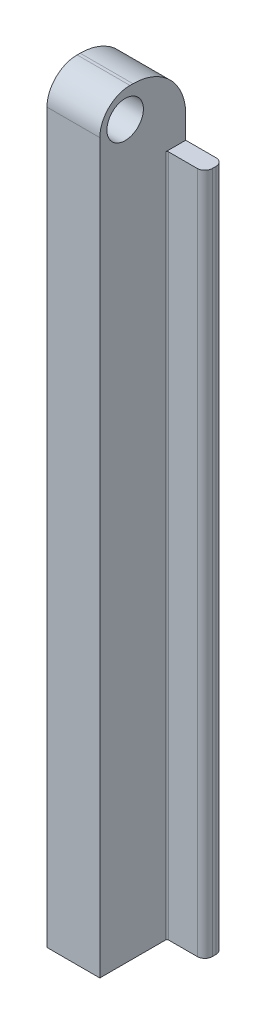
from build123d import *

# Parameters (mm, degrees)
SKETCH1_W           = 21.595753519
SKETCH1_H           = 14.478
BOSS_EXTRUDE1_DEPTH = 154.432
SKETCH2_W           = 6.322581804
SKETCH2_H           = 11.387875745
CUT_EXTRUDE1_DEPTH  = 169.418
SKETCH3_W           = 6.363734986
SKETCH3_H           = 11.33360049
CUT_EXTRUDE2_DEPTH  = 184.912
FILLET2_R           = 1.27
FILLET3_R           = 1.27
FILLET4_R           = 1.27
FILLET5_R           = 0.254
FILLET6_R           = 1.27
SKETCH5_R           = 3.075760473
CUT_EXTRUDE4_DEPTH  = 27.084813675
FILLET7_R           = 0.254
CUT_EXTRUDE5_DEPTH  = 26.67
SKETCH8_W           = 9.146003961
SKETCH8_H           = 12.7
CUT_EXTRUDE6_DEPTH  = 157.605337323
FILLET9_R           = 8.89
FILLET10_R          = 5.08


with BuildPart() as part:
    # Sketch1 → Boss-Extrude1 (new body)
    with BuildSketch(Plane(origin=(0, 0, 0), x_dir=(1, 0, 0), z_dir=(0, 1, 0))):
        with Locations((-10.79787676, -7.239)):
            Rectangle(SKETCH1_W, SKETCH1_H)
    extrude(amount=BOSS_EXTRUDE1_DEPTH)

    # Sketch2 → Cut-Extrude1 (cut)
    with BuildSketch(Plane(origin=(0, 154.432, 0), x_dir=(1, 0, 0), z_dir=(0, 1, 0))):
        with Locations((-18.434462617, -8.784062128)):
            Rectangle(SKETCH2_W, SKETCH2_H)
    extrude(amount=-CUT_EXTRUDE1_DEPTH, mode=Mode.SUBTRACT)

    # Sketch3 → Cut-Extrude2 (cut)
    with BuildSketch(Plane(origin=(0, 154.432, 0), x_dir=(1, 0, 0), z_dir=(0, 1, 0))):
        with Locations((-3.181867493, -8.811199755)):
            Rectangle(SKETCH3_W, SKETCH3_H)
    extrude(amount=-CUT_EXTRUDE2_DEPTH, mode=Mode.SUBTRACT)

    # Fillet2
    fillet2_edges = [part.edges().sort_by_distance(p)[0] for p in [
        (-21.595753519, 77.216, 3.090124255),
    ]]
    fillet(fillet2_edges, radius=FILLET2_R)

    # Fillet3
    fillet3_edges = [part.edges().sort_by_distance(p)[0] for p in [
        (-21.595753519, 77.216, 0),
    ]]
    fillet(fillet3_edges, radius=FILLET3_R)

    # Fillet4
    fillet4_edges = [part.edges().sort_by_distance(p)[0] for p in [
        (0, 77.216, 0),
    ]]
    fillet(fillet4_edges, radius=FILLET4_R)

    # Fillet5
    fillet5_edges = [part.edges().sort_by_distance(p)[0] for p in [
        (-6.363734986, 77.216, 3.14439951),
    ]]
    fillet(fillet5_edges, radius=FILLET5_R)

    # Fillet6
    fillet6_edges = [part.edges().sort_by_distance(p)[0] for p in [
        (0, 77.216, 3.14439951),
    ]]
    fillet(fillet6_edges, radius=FILLET6_R)

    # Sketch5 → Cut-Extrude4 (cut)
    with BuildSketch(Plane.ZY.offset(15.273171715)):
        with Locations((10.21002492, 149.86)):
            Circle(SKETCH5_R)
    extrude(amount=-CUT_EXTRUDE4_DEPTH, mode=Mode.SUBTRACT)

    # Fillet7
    fillet7_edges = [part.edges().sort_by_distance(p)[0] for p in [
        (-15.273171715, 77.216, 3.090124255),
    ]]
    fillet(fillet7_edges, radius=FILLET7_R)

    # Sketch6 → Cut-Extrude5 (cut)
    with BuildSketch(Plane.XZ):
        Polygon((0, 1.572199755), (0, 14.478), (-15.273171715, 14.478), (-21.595753519, 14.478), (-21.595753519, 1.545062127), (-21.595753519, 0), (0, 0), align=None)
    extrude(amount=-CUT_EXTRUDE5_DEPTH, mode=Mode.SUBTRACT)

    # Sketch8 → Cut-Extrude6 (cut, through all)
    with BuildSketch(Plane(origin=(0, 0, 0), x_dir=(-1, 0, 0), z_dir=(0, 0, -1))):
        with Locations((19.846173695, 148.082)):
            Rectangle(SKETCH8_W, SKETCH8_H)
    cut_extrude6 = extrude(amount=-CUT_EXTRUDE6_DEPTH, mode=Mode.SUBTRACT)

    # Mirror1: Cut-Extrude6 across plane
    add(cut_extrude6.mirror(Plane.ZY.offset(10.81845335)), mode=Mode.SUBTRACT)

    # Fillet9
    fillet9_edges = [part.edges().sort_by_distance(p)[0] for p in [
        (-10.81845335, 154.432, 0),
    ]]
    fillet(fillet9_edges, radius=FILLET9_R)

    # Fillet10
    fillet10_edges = [part.edges().sort_by_distance(p)[0] for p in [
        (-10.81845335, 154.432, 14.478),
    ]]
    fillet(fillet10_edges, radius=FILLET10_R)


solid = part.part
